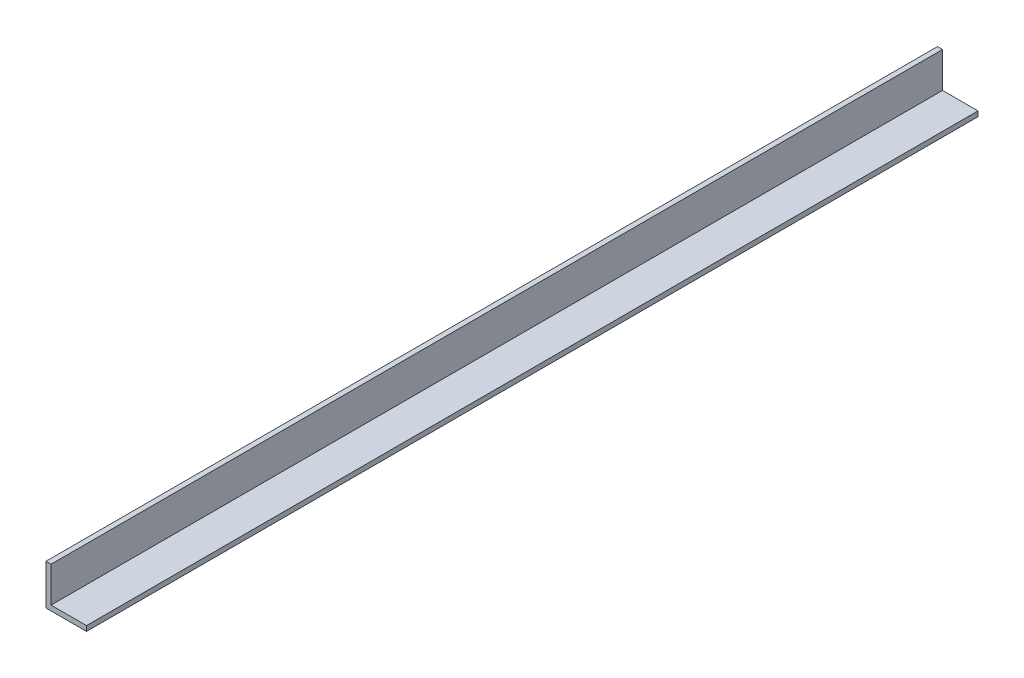
from build123d import *

# Parameters (mm, degrees)
BOSS_EXTRUDE1_DEPTH = 279.4


with BuildPart() as part:
    # Sketch1 → Boss-Extrude1 (new, symmetric)
    with BuildSketch(Plane.XY):
        Polygon((0, 25.4), (0, 0), (25.4, 0), (25.4, 3.175), (3.175, 3.175), (3.175, 25.4), align=None)
    extrude(amount=BOSS_EXTRUDE1_DEPTH, both=True)


solid = part.part
